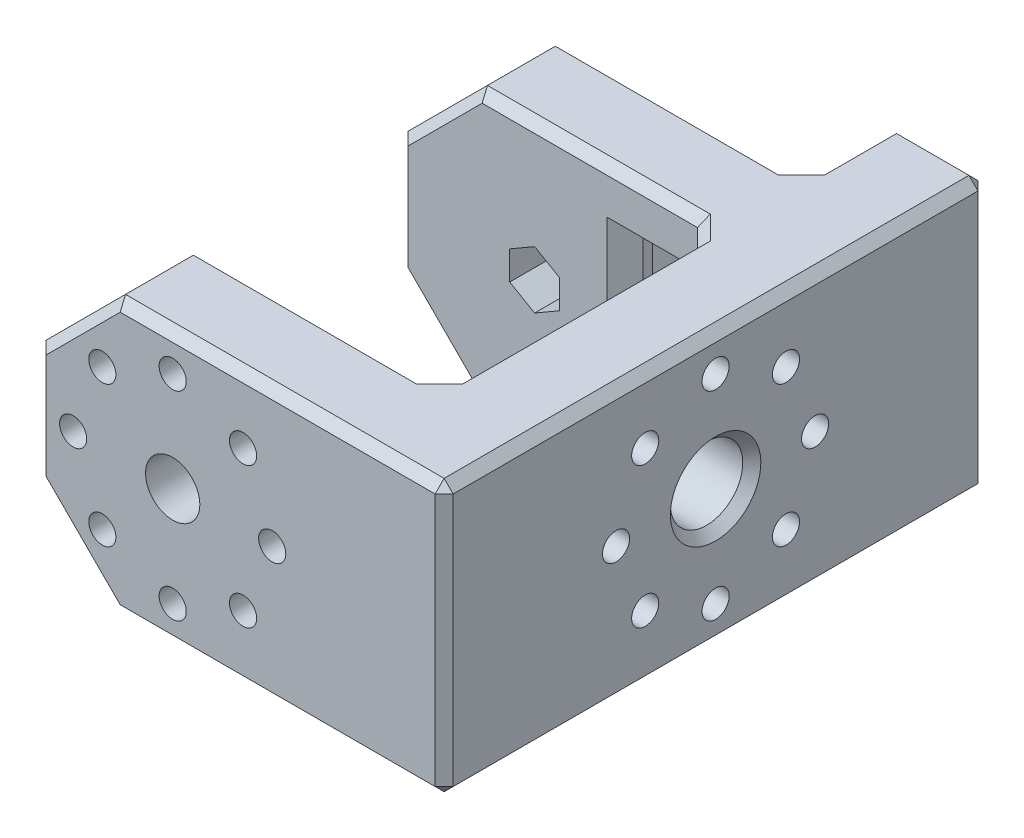
from build123d import *

# Parameters (mm, degrees)
SALIENTE_EXTRUIR1_DEPTH = 60
CROQUIS2_W              = 35
CROQUIS2_H              = 30.5
CROQUIS2_H_2            = 10.5
CORTAR_EXTRUIR1_DEPTH   = 74.484692283
CORTAR_EXTRUIR2_REACH   = 70.739
CROQUIS3_R              = 3
CROQUIS12_R             = 6
SALIENTE_EXTRUIR2_DEPTH = 1
CORTAR_EXTRUIR3_REACH   = 62.624
CROQUIS4_R              = 1.5
CORTAR_EXTRUIR4_DEPTH   = 5
CROQUIS9_W              = 10
CROQUIS9_H              = 20
CORTAR_EXTRUIR7_DEPTH   = 5
CORTAR_EXTRUIR5_REACH   = 78.485
CROQUIS7_R              = 4
CROQUIS7_R_2            = 1.5
CORTAR_EXTRUIR6_REACH   = 83.485
CORTAR_EXTRUIR6_START   = -5
CORTAR_EXTRUIR8_REACH   = 70.739
CROQUIS10_R             = 1.5
CORTAR_EXTRUIR9_REACH   = 75.739
CORTAR_EXTRUIR9_START   = -5
CHAFL_N5_SIZE           = 0.5
CHAFL_N6_SIZE           = 1
CHAFL_N4_SIZE           = 1
CHAFL_N3_SIZE           = 1
CHAFL_N1_SIZE           = 2
CHAFL_N2_SIZE           = 1


# Some blends are built 0.0001 mm under size
with BuildPart() as part:
    # Croquis1 → Saliente-Extruir1 (new body)
    with BuildSketch(Plane.XY):
        Polygon((6.213203436, 15), (30, 15), (30, -15), (6.213203436, -15), (-6.213203436, -15), (-15, -6.213203436), (-15, 6.213203436), (-6.213203436, 15), align=None)
    extrude(amount=SALIENTE_EXTRUIR1_DEPTH)

    # Croquis2 → Cortar-Extruir1 (cut, through all)
    with BuildSketch(Plane(origin=(0, 15, 0), x_dir=(1, 0, 0), z_dir=(0, 1, 0))):
        with Locations((2.5, -35.25)):
            Rectangle(CROQUIS2_W, CROQUIS2_H)
        with Locations((2.5, -5.25)):
            Rectangle(CROQUIS2_W, CROQUIS2_H_2)
    extrude(amount=-CORTAR_EXTRUIR1_DEPTH, mode=Mode.SUBTRACT)

    # Croquis3 → Cortar-Extruir2 (cut, up to next)
    with BuildSketch(Plane.XY.offset(60), mode=Mode.PRIVATE) as cortar_extruir2_sk1:
        Circle(CROQUIS3_R)
    cortar_extruir2_tool1 = extrude(cortar_extruir2_sk1.sketch, amount=-CORTAR_EXTRUIR2_REACH, mode=Mode.PRIVATE) & part.part
    add(cortar_extruir2_tool1.solids().sort_by_distance((0, 0, 60))[0], mode=Mode.SUBTRACT)

    # Croquis12 → Saliente-Extruir2 (add)
    with BuildSketch(Plane(origin=(0, 0, 10.5), x_dir=(-1, 0, 0), z_dir=(0, 0, -1))):
        with Locations(Location((0, 0, 0), (0, 0, 180))):
            Circle(CROQUIS12_R)
    extrude(amount=SALIENTE_EXTRUIR2_DEPTH)

    # Croquis4 → Cortar-Extruir3 (cut, up to next)
    with BuildSketch(Plane(origin=(0, 0, 9.5), x_dir=(-1, 0, 0), z_dir=(0, 0, -1)), mode=Mode.PRIVATE) as cortar_extruir3_sk1:
        Circle(CROQUIS4_R)
    cortar_extruir3_tool1 = extrude(cortar_extruir3_sk1.sketch, amount=-CORTAR_EXTRUIR3_REACH, mode=Mode.PRIVATE) & part.part
    add(cortar_extruir3_tool1.solids().sort_by_distance((0, 0, 9.5))[0], mode=Mode.SUBTRACT)

    # Croquis5 → Cortar-Extruir4 (cut)
    with BuildSketch(Plane.XY.offset(20)):
        Polygon((0, 3.175426481), (-2.75, 1.58771324), (-2.75, -1.58771324), (0, -3.175426481), (2.75, -1.58771324), (2.75, 1.58771324), align=None)
    extrude(amount=-CORTAR_EXTRUIR4_DEPTH, mode=Mode.SUBTRACT)

    # Croquis9 → Cortar-Extruir7 (cut)
    with BuildSketch(Plane.XY.offset(20)):
        with Locations((15, 0)):
            Rectangle(CROQUIS9_W, CROQUIS9_H)
    extrude(amount=-CORTAR_EXTRUIR7_DEPTH, mode=Mode.SUBTRACT)

    # Croquis7 → Cortar-Extruir5 (cut, up to next)
    with BuildSketch(Plane(origin=(30, 0, 0), x_dir=(0, 0, -1), z_dir=(1, 0, 0)), mode=Mode.PRIVATE) as cortar_extruir5_sk1:
        with Locations(Location((-30, 0, 0), (0, 0, 90))):
            Circle(CROQUIS7_R)
    cortar_extruir5_tool1 = extrude(cortar_extruir5_sk1.sketch, amount=-CORTAR_EXTRUIR5_REACH, mode=Mode.PRIVATE) & part.part
    # Croquis7 → Cortar-Extruir5 (cut, up to next)
    with BuildSketch(Plane(origin=(30, 0, 0), x_dir=(0, 0, -1), z_dir=(1, 0, 0)), mode=Mode.PRIVATE) as cortar_extruir5_sk2:
        with Locations(Location((-30, 11, 0), (0, 0, 90))):
            Circle(CROQUIS7_R_2)
    cortar_extruir5_tool2 = extrude(cortar_extruir5_sk2.sketch, amount=-CORTAR_EXTRUIR5_REACH, mode=Mode.PRIVATE) & part.part
    # Croquis7 → Cortar-Extruir5 (cut, up to next)
    with BuildSketch(Plane(origin=(30, 0, 0), x_dir=(0, 0, -1), z_dir=(1, 0, 0)), mode=Mode.PRIVATE) as cortar_extruir5_sk3:
        with Locations(Location((-22.221825407, 7.778174593, 0), (0, 0, 90))):
            Circle(CROQUIS7_R_2)
    cortar_extruir5_tool3 = extrude(cortar_extruir5_sk3.sketch, amount=-CORTAR_EXTRUIR5_REACH, mode=Mode.PRIVATE) & part.part
    # Croquis7 → Cortar-Extruir5 (cut, up to next)
    with BuildSketch(Plane(origin=(30, 0, 0), x_dir=(0, 0, -1), z_dir=(1, 0, 0)), mode=Mode.PRIVATE) as cortar_extruir5_sk4:
        with Locations(Location((-19, 0, 0), (0, 0, 90))):
            Circle(CROQUIS7_R_2)
    cortar_extruir5_tool4 = extrude(cortar_extruir5_sk4.sketch, amount=-CORTAR_EXTRUIR5_REACH, mode=Mode.PRIVATE) & part.part
    # Croquis7 → Cortar-Extruir5 (cut, up to next)
    with BuildSketch(Plane(origin=(30, 0, 0), x_dir=(0, 0, -1), z_dir=(1, 0, 0)), mode=Mode.PRIVATE) as cortar_extruir5_sk5:
        with Locations(Location((-22.221825407, -7.778174593, 0), (0, 0, 90))):
            Circle(CROQUIS7_R_2)
    cortar_extruir5_tool5 = extrude(cortar_extruir5_sk5.sketch, amount=-CORTAR_EXTRUIR5_REACH, mode=Mode.PRIVATE) & part.part
    # Croquis7 → Cortar-Extruir5 (cut, up to next)
    with BuildSketch(Plane(origin=(30, 0, 0), x_dir=(0, 0, -1), z_dir=(1, 0, 0)), mode=Mode.PRIVATE) as cortar_extruir5_sk6:
        with Locations(Location((-30, -11, 0), (0, 0, 90))):
            Circle(CROQUIS7_R_2)
    cortar_extruir5_tool6 = extrude(cortar_extruir5_sk6.sketch, amount=-CORTAR_EXTRUIR5_REACH, mode=Mode.PRIVATE) & part.part
    # Croquis7 → Cortar-Extruir5 (cut, up to next)
    with BuildSketch(Plane(origin=(30, 0, 0), x_dir=(0, 0, -1), z_dir=(1, 0, 0)), mode=Mode.PRIVATE) as cortar_extruir5_sk7:
        with Locations(Location((-37.778174593, -7.778174593, 0), (0, 0, 90))):
            Circle(CROQUIS7_R_2)
    cortar_extruir5_tool7 = extrude(cortar_extruir5_sk7.sketch, amount=-CORTAR_EXTRUIR5_REACH, mode=Mode.PRIVATE) & part.part
    # Croquis7 → Cortar-Extruir5 (cut, up to next)
    with BuildSketch(Plane(origin=(30, 0, 0), x_dir=(0, 0, -1), z_dir=(1, 0, 0)), mode=Mode.PRIVATE) as cortar_extruir5_sk8:
        with Locations(Location((-41, 0, 0), (0, 0, 90))):
            Circle(CROQUIS7_R_2)
    cortar_extruir5_tool8 = extrude(cortar_extruir5_sk8.sketch, amount=-CORTAR_EXTRUIR5_REACH, mode=Mode.PRIVATE) & part.part
    # Croquis7 → Cortar-Extruir5 (cut, up to next)
    with BuildSketch(Plane(origin=(30, 0, 0), x_dir=(0, 0, -1), z_dir=(1, 0, 0)), mode=Mode.PRIVATE) as cortar_extruir5_sk9:
        with Locations(Location((-37.778174593, 7.778174593, 0), (0, 0, 90))):
            Circle(CROQUIS7_R_2)
    cortar_extruir5_tool9 = extrude(cortar_extruir5_sk9.sketch, amount=-CORTAR_EXTRUIR5_REACH, mode=Mode.PRIVATE) & part.part
    add(cortar_extruir5_tool1.solids().sort_by_distance((30, 0, 30))[0], mode=Mode.SUBTRACT)
    add(cortar_extruir5_tool2.solids().sort_by_distance((30, 11, 30))[0], mode=Mode.SUBTRACT)
    add(cortar_extruir5_tool3.solids().sort_by_distance((30, 7.778175, 22.221825))[0], mode=Mode.SUBTRACT)
    add(cortar_extruir5_tool4.solids().sort_by_distance((30, 0, 19))[0], mode=Mode.SUBTRACT)
    add(cortar_extruir5_tool5.solids().sort_by_distance((30, -7.778175, 22.221825))[0], mode=Mode.SUBTRACT)
    add(cortar_extruir5_tool6.solids().sort_by_distance((30, -11, 30))[0], mode=Mode.SUBTRACT)
    add(cortar_extruir5_tool7.solids().sort_by_distance((30, -7.778175, 37.778175))[0], mode=Mode.SUBTRACT)
    add(cortar_extruir5_tool8.solids().sort_by_distance((30, 0, 41))[0], mode=Mode.SUBTRACT)
    add(cortar_extruir5_tool9.solids().sort_by_distance((30, 7.778175, 37.778175))[0], mode=Mode.SUBTRACT)

    # Croquis8 → Cortar-Extruir6 (cut, up to next)
    with BuildSketch(Plane(origin=(30, 0, 0), x_dir=(0, 0, -1), z_dir=(1, 0, 0)).offset(CORTAR_EXTRUIR6_START), mode=Mode.PRIVATE) as cortar_extruir6_sk1:
        Polygon((-19.976459809, 5.532808996), (-19.15459896, 8.600035443), (-21.399964557, 10.84540104), (-24.467191004, 10.023540191), (-25.289051854, 6.956313744), (-23.043686256, 4.710948146), align=None)
    cortar_extruir6_tool1 = extrude(cortar_extruir6_sk1.sketch, amount=-CORTAR_EXTRUIR6_REACH, mode=Mode.PRIVATE) & part.part
    # Croquis8 → Cortar-Extruir6 (cut, up to next)
    with BuildSketch(Plane(origin=(30, 0, 0), x_dir=(0, 0, -1), z_dir=(1, 0, 0)).offset(CORTAR_EXTRUIR6_START), mode=Mode.PRIVATE) as cortar_extruir6_sk2:
        Polygon((-26.824573519, 11), (-28.41228676, 13.75), (-31.58771324, 13.75), (-33.175426481, 11), (-31.58771324, 8.25), (-28.41228676, 8.25), align=None)
    cortar_extruir6_tool2 = extrude(cortar_extruir6_sk2.sketch, amount=-CORTAR_EXTRUIR6_REACH, mode=Mode.PRIVATE) & part.part
    # Croquis8 → Cortar-Extruir6 (cut, up to next)
    with BuildSketch(Plane(origin=(30, 0, 0), x_dir=(0, 0, -1), z_dir=(1, 0, 0)).offset(CORTAR_EXTRUIR6_START), mode=Mode.PRIVATE) as cortar_extruir6_sk3:
        Polygon((-19, -3.175426481), (-16.25, -1.58771324), (-16.25, 1.58771324), (-19, 3.175426481), (-21.75, 1.58771324), (-21.75, -1.58771324), align=None)
    cortar_extruir6_tool3 = extrude(cortar_extruir6_sk3.sketch, amount=-CORTAR_EXTRUIR6_REACH, mode=Mode.PRIVATE) & part.part
    # Croquis8 → Cortar-Extruir6 (cut, up to next)
    with BuildSketch(Plane(origin=(30, 0, 0), x_dir=(0, 0, -1), z_dir=(1, 0, 0)).offset(CORTAR_EXTRUIR6_START), mode=Mode.PRIVATE) as cortar_extruir6_sk4:
        Polygon((-24.467191004, -10.023540191), (-21.399964557, -10.84540104), (-19.15459896, -8.600035443), (-19.976459809, -5.532808996), (-23.043686256, -4.710948146), (-25.289051854, -6.956313744), align=None)
    cortar_extruir6_tool4 = extrude(cortar_extruir6_sk4.sketch, amount=-CORTAR_EXTRUIR6_REACH, mode=Mode.PRIVATE) & part.part
    # Croquis8 → Cortar-Extruir6 (cut, up to next)
    with BuildSketch(Plane(origin=(30, 0, 0), x_dir=(0, 0, -1), z_dir=(1, 0, 0)).offset(CORTAR_EXTRUIR6_START), mode=Mode.PRIVATE) as cortar_extruir6_sk5:
        Polygon((-33.175426481, -11), (-31.58771324, -13.75), (-28.41228676, -13.75), (-26.824573519, -11), (-28.41228676, -8.25), (-31.58771324, -8.25), align=None)
    cortar_extruir6_tool5 = extrude(cortar_extruir6_sk5.sketch, amount=-CORTAR_EXTRUIR6_REACH, mode=Mode.PRIVATE) & part.part
    # Croquis8 → Cortar-Extruir6 (cut, up to next)
    with BuildSketch(Plane(origin=(30, 0, 0), x_dir=(0, 0, -1), z_dir=(1, 0, 0)).offset(CORTAR_EXTRUIR6_START), mode=Mode.PRIVATE) as cortar_extruir6_sk6:
        Polygon((-40.023540191, -5.532808996), (-40.84540104, -8.600035443), (-38.600035443, -10.84540104), (-35.532808996, -10.023540191), (-34.710948146, -6.956313744), (-36.956313744, -4.710948146), align=None)
    cortar_extruir6_tool6 = extrude(cortar_extruir6_sk6.sketch, amount=-CORTAR_EXTRUIR6_REACH, mode=Mode.PRIVATE) & part.part
    # Croquis8 → Cortar-Extruir6 (cut, up to next)
    with BuildSketch(Plane(origin=(30, 0, 0), x_dir=(0, 0, -1), z_dir=(1, 0, 0)).offset(CORTAR_EXTRUIR6_START), mode=Mode.PRIVATE) as cortar_extruir6_sk7:
        Polygon((-41, 3.175426481), (-43.75, 1.58771324), (-43.75, -1.58771324), (-41, -3.175426481), (-38.25, -1.58771324), (-38.25, 1.58771324), align=None)
    cortar_extruir6_tool7 = extrude(cortar_extruir6_sk7.sketch, amount=-CORTAR_EXTRUIR6_REACH, mode=Mode.PRIVATE) & part.part
    # Croquis8 → Cortar-Extruir6 (cut, up to next)
    with BuildSketch(Plane(origin=(30, 0, 0), x_dir=(0, 0, -1), z_dir=(1, 0, 0)).offset(CORTAR_EXTRUIR6_START), mode=Mode.PRIVATE) as cortar_extruir6_sk8:
        Polygon((-35.532808996, 10.023540191), (-38.600035443, 10.84540104), (-40.84540104, 8.600035443), (-40.023540191, 5.532808996), (-36.956313744, 4.710948146), (-34.710948146, 6.956313744), align=None)
    cortar_extruir6_tool8 = extrude(cortar_extruir6_sk8.sketch, amount=-CORTAR_EXTRUIR6_REACH, mode=Mode.PRIVATE) & part.part
    add(cortar_extruir6_tool1.solids().sort_by_distance((25, 7.778175, 22.221825))[0], mode=Mode.SUBTRACT)
    add(cortar_extruir6_tool2.solids().sort_by_distance((25, 11, 30))[0], mode=Mode.SUBTRACT)
    add(cortar_extruir6_tool3.solids().sort_by_distance((25, 0, 19))[0], mode=Mode.SUBTRACT)
    add(cortar_extruir6_tool4.solids().sort_by_distance((25, -7.778175, 22.221825))[0], mode=Mode.SUBTRACT)
    add(cortar_extruir6_tool5.solids().sort_by_distance((25, -11, 30))[0], mode=Mode.SUBTRACT)
    add(cortar_extruir6_tool6.solids().sort_by_distance((25, -7.778175, 37.778175))[0], mode=Mode.SUBTRACT)
    add(cortar_extruir6_tool7.solids().sort_by_distance((25, 0, 41))[0], mode=Mode.SUBTRACT)
    add(cortar_extruir6_tool8.solids().sort_by_distance((25, 7.778175, 37.778175))[0], mode=Mode.SUBTRACT)

    # Croquis10 → Cortar-Extruir8 (cut, up to next)
    with BuildSketch(Plane.XY.offset(60), mode=Mode.PRIVATE) as cortar_extruir8_sk1:
        with Locations((0, 11)):
            Circle(CROQUIS10_R)
    cortar_extruir8_tool1 = extrude(cortar_extruir8_sk1.sketch, amount=-CORTAR_EXTRUIR8_REACH, mode=Mode.PRIVATE) & part.part
    # Croquis10 → Cortar-Extruir8 (cut, up to next)
    with BuildSketch(Plane.XY.offset(60), mode=Mode.PRIVATE) as cortar_extruir8_sk2:
        with Locations((7.778174593, 7.778174593)):
            Circle(CROQUIS10_R)
    cortar_extruir8_tool2 = extrude(cortar_extruir8_sk2.sketch, amount=-CORTAR_EXTRUIR8_REACH, mode=Mode.PRIVATE) & part.part
    # Croquis10 → Cortar-Extruir8 (cut, up to next)
    with BuildSketch(Plane.XY.offset(60), mode=Mode.PRIVATE) as cortar_extruir8_sk3:
        with Locations((11, 0)):
            Circle(CROQUIS10_R)
    cortar_extruir8_tool3 = extrude(cortar_extruir8_sk3.sketch, amount=-CORTAR_EXTRUIR8_REACH, mode=Mode.PRIVATE) & part.part
    # Croquis10 → Cortar-Extruir8 (cut, up to next)
    with BuildSketch(Plane.XY.offset(60), mode=Mode.PRIVATE) as cortar_extruir8_sk4:
        with Locations((7.778174593, -7.778174593)):
            Circle(CROQUIS10_R)
    cortar_extruir8_tool4 = extrude(cortar_extruir8_sk4.sketch, amount=-CORTAR_EXTRUIR8_REACH, mode=Mode.PRIVATE) & part.part
    # Croquis10 → Cortar-Extruir8 (cut, up to next)
    with BuildSketch(Plane.XY.offset(60), mode=Mode.PRIVATE) as cortar_extruir8_sk5:
        with Locations((0, -11)):
            Circle(CROQUIS10_R)
    cortar_extruir8_tool5 = extrude(cortar_extruir8_sk5.sketch, amount=-CORTAR_EXTRUIR8_REACH, mode=Mode.PRIVATE) & part.part
    # Croquis10 → Cortar-Extruir8 (cut, up to next)
    with BuildSketch(Plane.XY.offset(60), mode=Mode.PRIVATE) as cortar_extruir8_sk6:
        with Locations((-7.778174593, -7.778174593)):
            Circle(CROQUIS10_R)
    cortar_extruir8_tool6 = extrude(cortar_extruir8_sk6.sketch, amount=-CORTAR_EXTRUIR8_REACH, mode=Mode.PRIVATE) & part.part
    # Croquis10 → Cortar-Extruir8 (cut, up to next)
    with BuildSketch(Plane.XY.offset(60), mode=Mode.PRIVATE) as cortar_extruir8_sk7:
        with Locations((-11, 0)):
            Circle(CROQUIS10_R)
    cortar_extruir8_tool7 = extrude(cortar_extruir8_sk7.sketch, amount=-CORTAR_EXTRUIR8_REACH, mode=Mode.PRIVATE) & part.part
    # Croquis10 → Cortar-Extruir8 (cut, up to next)
    with BuildSketch(Plane.XY.offset(60), mode=Mode.PRIVATE) as cortar_extruir8_sk8:
        with Locations((-7.778174593, 7.778174593)):
            Circle(CROQUIS10_R)
    cortar_extruir8_tool8 = extrude(cortar_extruir8_sk8.sketch, amount=-CORTAR_EXTRUIR8_REACH, mode=Mode.PRIVATE) & part.part
    add(cortar_extruir8_tool1.solids().sort_by_distance((0, 11, 60))[0], mode=Mode.SUBTRACT)
    add(cortar_extruir8_tool2.solids().sort_by_distance((7.778175, 7.778175, 60))[0], mode=Mode.SUBTRACT)
    add(cortar_extruir8_tool3.solids().sort_by_distance((11, 0, 60))[0], mode=Mode.SUBTRACT)
    add(cortar_extruir8_tool4.solids().sort_by_distance((7.778175, -7.778175, 60))[0], mode=Mode.SUBTRACT)
    add(cortar_extruir8_tool5.solids().sort_by_distance((0, -11, 60))[0], mode=Mode.SUBTRACT)
    add(cortar_extruir8_tool6.solids().sort_by_distance((-7.778175, -7.778175, 60))[0], mode=Mode.SUBTRACT)
    add(cortar_extruir8_tool7.solids().sort_by_distance((-11, 0, 60))[0], mode=Mode.SUBTRACT)
    add(cortar_extruir8_tool8.solids().sort_by_distance((-7.778175, 7.778175, 60))[0], mode=Mode.SUBTRACT)

    # Croquis11 → Cortar-Extruir9 (cut, up to next)
    with BuildSketch(Plane.XY.offset(60).offset(CORTAR_EXTRUIR9_START), mode=Mode.PRIVATE) as cortar_extruir9_sk1:
        Polygon((10.023540191, 5.532808996), (10.84540104, 8.600035443), (8.600035443, 10.84540104), (5.532808996, 10.023540191), (4.710948146, 6.956313744), (6.956313744, 4.710948146), align=None)
    cortar_extruir9_tool1 = extrude(cortar_extruir9_sk1.sketch, amount=-CORTAR_EXTRUIR9_REACH, mode=Mode.PRIVATE) & part.part
    # Croquis11 → Cortar-Extruir9 (cut, up to next)
    with BuildSketch(Plane.XY.offset(60).offset(CORTAR_EXTRUIR9_START), mode=Mode.PRIVATE) as cortar_extruir9_sk2:
        Polygon((3.175426481, 11), (1.58771324, 13.75), (-1.58771324, 13.75), (-3.175426481, 11), (-1.58771324, 8.25), (1.58771324, 8.25), align=None)
    cortar_extruir9_tool2 = extrude(cortar_extruir9_sk2.sketch, amount=-CORTAR_EXTRUIR9_REACH, mode=Mode.PRIVATE) & part.part
    # Croquis11 → Cortar-Extruir9 (cut, up to next)
    with BuildSketch(Plane.XY.offset(60).offset(CORTAR_EXTRUIR9_START), mode=Mode.PRIVATE) as cortar_extruir9_sk3:
        Polygon((11, -3.175426481), (13.75, -1.58771324), (13.75, 1.58771324), (11, 3.175426481), (8.25, 1.58771324), (8.25, -1.58771324), align=None)
    cortar_extruir9_tool3 = extrude(cortar_extruir9_sk3.sketch, amount=-CORTAR_EXTRUIR9_REACH, mode=Mode.PRIVATE) & part.part
    # Croquis11 → Cortar-Extruir9 (cut, up to next)
    with BuildSketch(Plane.XY.offset(60).offset(CORTAR_EXTRUIR9_START), mode=Mode.PRIVATE) as cortar_extruir9_sk4:
        Polygon((5.532808996, -10.023540191), (8.600035443, -10.84540104), (10.84540104, -8.600035443), (10.023540191, -5.532808996), (6.956313744, -4.710948146), (4.710948146, -6.956313744), align=None)
    cortar_extruir9_tool4 = extrude(cortar_extruir9_sk4.sketch, amount=-CORTAR_EXTRUIR9_REACH, mode=Mode.PRIVATE) & part.part
    # Croquis11 → Cortar-Extruir9 (cut, up to next)
    with BuildSketch(Plane.XY.offset(60).offset(CORTAR_EXTRUIR9_START), mode=Mode.PRIVATE) as cortar_extruir9_sk5:
        Polygon((-3.175426481, -11), (-1.58771324, -13.75), (1.58771324, -13.75), (3.175426481, -11), (1.58771324, -8.25), (-1.58771324, -8.25), align=None)
    cortar_extruir9_tool5 = extrude(cortar_extruir9_sk5.sketch, amount=-CORTAR_EXTRUIR9_REACH, mode=Mode.PRIVATE) & part.part
    # Croquis11 → Cortar-Extruir9 (cut, up to next)
    with BuildSketch(Plane.XY.offset(60).offset(CORTAR_EXTRUIR9_START), mode=Mode.PRIVATE) as cortar_extruir9_sk6:
        Polygon((-10.023540191, -5.532808996), (-10.84540104, -8.600035443), (-8.600035443, -10.84540104), (-5.532808995, -10.023540191), (-4.710948146, -6.956313744), (-6.956313744, -4.710948146), align=None)
    cortar_extruir9_tool6 = extrude(cortar_extruir9_sk6.sketch, amount=-CORTAR_EXTRUIR9_REACH, mode=Mode.PRIVATE) & part.part
    # Croquis11 → Cortar-Extruir9 (cut, up to next)
    with BuildSketch(Plane.XY.offset(60).offset(CORTAR_EXTRUIR9_START), mode=Mode.PRIVATE) as cortar_extruir9_sk7:
        Polygon((-11, 3.175426481), (-13.75, 1.58771324), (-13.75, -1.58771324), (-11, -3.175426481), (-8.25, -1.58771324), (-8.25, 1.58771324), align=None)
    cortar_extruir9_tool7 = extrude(cortar_extruir9_sk7.sketch, amount=-CORTAR_EXTRUIR9_REACH, mode=Mode.PRIVATE) & part.part
    # Croquis11 → Cortar-Extruir9 (cut, up to next)
    with BuildSketch(Plane.XY.offset(60).offset(CORTAR_EXTRUIR9_START), mode=Mode.PRIVATE) as cortar_extruir9_sk8:
        Polygon((-5.532808996, 10.023540191), (-8.600035443, 10.84540104), (-10.84540104, 8.600035443), (-10.023540191, 5.532808996), (-6.956313744, 4.710948146), (-4.710948146, 6.956313744), align=None)
    cortar_extruir9_tool8 = extrude(cortar_extruir9_sk8.sketch, amount=-CORTAR_EXTRUIR9_REACH, mode=Mode.PRIVATE) & part.part
    add(cortar_extruir9_tool1.solids().sort_by_distance((7.778175, 7.778175, 55))[0], mode=Mode.SUBTRACT)
    add(cortar_extruir9_tool2.solids().sort_by_distance((0, 11, 55))[0], mode=Mode.SUBTRACT)
    add(cortar_extruir9_tool3.solids().sort_by_distance((11, 0, 55))[0], mode=Mode.SUBTRACT)
    add(cortar_extruir9_tool4.solids().sort_by_distance((7.778175, -7.778175, 55))[0], mode=Mode.SUBTRACT)
    add(cortar_extruir9_tool5.solids().sort_by_distance((0, -11, 55))[0], mode=Mode.SUBTRACT)
    add(cortar_extruir9_tool6.solids().sort_by_distance((-7.778175, -7.778175, 55))[0], mode=Mode.SUBTRACT)
    add(cortar_extruir9_tool7.solids().sort_by_distance((-11, 0, 55))[0], mode=Mode.SUBTRACT)
    add(cortar_extruir9_tool8.solids().sort_by_distance((-7.778175, 7.778175, 55))[0], mode=Mode.SUBTRACT)

    # Chaflán5
    chafl_n5_edges = [part.edges().sort_by_distance(p)[0] for p in [
        (1.5, 0, 9.5),
    ]]
    chamfer(chafl_n5_edges, length=CHAFL_N5_SIZE)

    # Chaflán6
    chafl_n6_edges = [part.edges().sort_by_distance(p)[0] for p in [
        (-6, 0, 10.5),
    ]]
    chamfer(chafl_n6_edges, length=CHAFL_N6_SIZE - 0.0001)  # a hair under: the kernel refuses the full size

    # Chaflán4
    chafl_n4_edges = [part.edges().sort_by_distance(p)[0] for p in [
        (30, -4, 30),
        (20, -4, 30),
    ]]
    chamfer(chafl_n4_edges, length=CHAFL_N4_SIZE)

    # Chaflán3
    chafl_n3_edges = [part.edges().sort_by_distance(p)[0] for p in [
        (-3, 0, 50.5),
    ]]
    chamfer(chafl_n3_edges, length=CHAFL_N3_SIZE)

    # Chaflán1
    # the kernel refuses this chamfer: 2 mm, written as the material it adds along each edge
    with BuildSketch(Plane(origin=(20, 15, 50.5), x_dir=(-0.9996219169112968, 0, 0.027495876610585647), z_dir=(0, -1, 0)), Plane(origin=(20, 15, 10.5), x_dir=(-0.9996219169112968, 0, 0.02749587661058651), z_dir=(0, -1, 0))) as chafl_n1_piece_1:
        Polygon((CHAFL_N1_SIZE * 0.999621916911, CHAFL_N1_SIZE * 0.0274958766106), (-CHAFL_N1_SIZE * 0.0274958766106, CHAFL_N1_SIZE * 0.999621916911), (0, 0), align=None)
    extrude(amount=30)
    with BuildSketch(Plane(origin=(20, -10, 20), x_dir=(0.027495876610585647, 0, 0.9996219169112968), z_dir=(0, -1, 0))) as chafl_n1_piece_2_section:
        Polygon((CHAFL_N1_SIZE * 0.999621916911, CHAFL_N1_SIZE * 0.0274958766106), (-CHAFL_N1_SIZE * 0.0274958766106, CHAFL_N1_SIZE * 0.999621916911), (0, 0), align=None)
    chafl_n1_piece_2 = extrude(amount=5, mode=Mode.PRIVATE)
    chafl_n1_piece_2 = split(chafl_n1_piece_2, bisect_by=Plane(origin=(19.216720762, -10.235610769, 20.790174286), z_dir=(0, -0.7071067811865523, -0.7071067811865428)), keep=Keep.TOP, mode=Mode.PRIVATE)
    add(chafl_n1_piece_2)
    with BuildSketch(Plane(origin=(20, -4.856634024, 20), x_dir=(0.027495876610585647, 0, 0.9996219169112968), z_dir=(0, -1, 0))) as chafl_n1_piece_3_section:
        Polygon((CHAFL_N1_SIZE * 0.999621916911, CHAFL_N1_SIZE * 0.0274958766106), (-CHAFL_N1_SIZE * 0.0274958766106, CHAFL_N1_SIZE * 0.999621916911), (0, 0), align=None)
    chafl_n1_piece_3 = extrude(amount=15.286731952, mode=Mode.PRIVATE)
    chafl_n1_piece_3 = split(chafl_n1_piece_3, bisect_by=Plane(origin=(19.849991139, -11.050316955, 21.604880472), z_dir=(0, 0.7071067811865523, 0.7071067811865428)), keep=Keep.TOP, mode=Mode.PRIVATE)
    chafl_n1_piece_3 = split(chafl_n1_piece_3, bisect_by=Plane(origin=(19.849991139, -10.77775276, 21.652431375), z_dir=(0, -0.9659258262890669, 0.2588190451025261)), keep=Keep.TOP, mode=Mode.PRIVATE)
    add(chafl_n1_piece_3)
    with BuildSketch(Plane(origin=(20, 15, 20), x_dir=(0.027495876610585647, 0, 0.9996219169112968), z_dir=(0, -1, 0))) as chafl_n1_piece_4_section:
        Polygon((CHAFL_N1_SIZE * 0.999621916911, CHAFL_N1_SIZE * 0.0274958766106), (-CHAFL_N1_SIZE * 0.0274958766106, CHAFL_N1_SIZE * 0.999621916911), (0, 0), align=None)
    chafl_n1_piece_4 = extrude(amount=10.143365976, mode=Mode.PRIVATE)
    chafl_n1_piece_4 = split(chafl_n1_piece_4, bisect_by=Plane(origin=(19.337901825, 11.172841883, 20.177938697), z_dir=(0, 0.965925826289068, 0.2588190451025222)), keep=Keep.TOP, mode=Mode.PRIVATE)
    add(chafl_n1_piece_4)
    with BuildSketch(Plane(origin=(20, 20.143365976, 20), x_dir=(0.027495876610585647, 0, 0.9996219169112968), z_dir=(0, -1, 0))) as chafl_n1_piece_5_section:
        Polygon((CHAFL_N1_SIZE * 0.999621916911, CHAFL_N1_SIZE * 0.0274958766106), (-CHAFL_N1_SIZE * 0.0274958766106, CHAFL_N1_SIZE * 0.999621916911), (0, 0), align=None)
    chafl_n1_piece_5 = extrude(amount=10.143365976, mode=Mode.PRIVATE)
    chafl_n1_piece_5 = split(chafl_n1_piece_5, bisect_by=Plane(origin=(19.216720762, 10.235610769, 20.790174286), z_dir=(0, 0.7071067811865456, -0.7071067811865496)), keep=Keep.TOP, mode=Mode.PRIVATE)
    chafl_n1_piece_5 = split(chafl_n1_piece_5, bisect_by=Plane(origin=(19.216720762, 11.07008016, 20.561450667), z_dir=(0, -0.965925826289068, -0.2588190451025222)), keep=Keep.TOP, mode=Mode.PRIVATE)
    add(chafl_n1_piece_5)
    with BuildSketch(Plane(origin=(20, 10, 15), x_dir=(0.027495876610582247, 0, 0.999621916911297), z_dir=(0, -1, 0))) as chafl_n1_piece_6_section:
        Polygon((CHAFL_N1_SIZE * 0.999621916911, CHAFL_N1_SIZE * 0.0274958766106), (-CHAFL_N1_SIZE * 0.0274958766106, CHAFL_N1_SIZE * 0.999621916911), (0, 0), align=None)
    chafl_n1_piece_6 = extrude(amount=25.143365976, mode=Mode.PRIVATE)
    chafl_n1_piece_6 = split(chafl_n1_piece_6, bisect_by=Plane(origin=(19.748908907, 2.764442057, 18.288154097), z_dir=(0, 0.8660254037844382, -0.5000000000000009)), keep=Keep.TOP, mode=Mode.PRIVATE)
    add(chafl_n1_piece_6)
    with BuildSketch(Plane(origin=(20, 15.143365976, 15), x_dir=(0.027495876610585647, 0, 0.9996219169112968), z_dir=(0, -1, 0))) as chafl_n1_piece_7_section:
        Polygon((CHAFL_N1_SIZE * 0.999621916911, CHAFL_N1_SIZE * 0.0274958766106), (-CHAFL_N1_SIZE * 0.0274958766106, CHAFL_N1_SIZE * 0.999621916911), (0, 0), align=None)
    chafl_n1_piece_7 = extrude(amount=25.143365976, mode=Mode.PRIVATE)
    chafl_n1_piece_7 = split(chafl_n1_piece_7, bisect_by=Plane(origin=(19.295009328, 0, 16.25), z_dir=(0, 0, -1)), keep=Keep.TOP, mode=Mode.PRIVATE)
    chafl_n1_piece_7 = split(chafl_n1_piece_7, bisect_by=Plane(origin=(19.295009328, 0.905004626, 15.067513993), z_dir=(0, -0.8660254037844382, 0.5000000000000009)), keep=Keep.TOP, mode=Mode.PRIVATE)
    add(chafl_n1_piece_7)
    with BuildSketch(Plane(origin=(20, 15.143365976, 15), x_dir=(0.027495876610585647, 0, 0.9996219169112968), z_dir=(0, -1, 0))) as chafl_n1_piece_8_section:
        Polygon((CHAFL_N1_SIZE * 0.999621916911, CHAFL_N1_SIZE * 0.0274958766106), (-CHAFL_N1_SIZE * 0.0274958766106, CHAFL_N1_SIZE * 0.999621916911), (0, 0), align=None)
    chafl_n1_piece_8 = extrude(amount=25.143365976, mode=Mode.PRIVATE)
    chafl_n1_piece_8 = split(chafl_n1_piece_8, bisect_by=Plane(origin=(19.748908907, -2.764442057, 18.288154097), z_dir=(0, -0.8660254037844408, -0.49999999999999617)), keep=Keep.TOP, mode=Mode.PRIVATE)
    add(chafl_n1_piece_8)
    with BuildSketch(Plane(origin=(10, -10, 15), x_dir=(0.9996219169112968, 0, -0.027495876610586487), z_dir=(0, 1, 0))) as chafl_n1_piece_9:
        Polygon((CHAFL_N1_SIZE * 0.999621916911, -CHAFL_N1_SIZE * 0.0274958766106), (-CHAFL_N1_SIZE * 0.0274958766106, -CHAFL_N1_SIZE * 0.999621916911), (0, 0), align=None)
    extrude(amount=20)
    # the kernel refuses this chamfer: 2 mm, written as the material it takes off along each edge
    with BuildSketch(Plane(origin=(10, -10, 20), x_dir=(-0.9996219169112968, 0, 0.027495876610585623), z_dir=(0, 1, 0))) as chafl_n1_2_piece_1:
        Polygon((CHAFL_N1_SIZE * 0.999621916911, -CHAFL_N1_SIZE * 0.0274958766106), (-CHAFL_N1_SIZE * 0.0274958766106, -CHAFL_N1_SIZE * 0.999621916911), (0, 0), align=None)
    extrude(amount=20, mode=Mode.SUBTRACT)

    # Chaflán2
    chafl_n2_edges = [part.edges().sort_by_distance(p)[0] for p in [
        (11.893398282, 15, 60),
        (30, 0, 0),
        (30, 15, 30),
        (30, -15, 30),
        (-10.606601718, 10.606601718, 60),
        (-15, 0, 60),
        (-10.606601718, -10.606601718, 60),
        (25, -15, 0),
        (5.893398282, -15, 50.5),
        (5.893398282, 15, 50.5),
        (-15, 0, 50.5),
        (-15, 0, 20),
        (-10.606601718, 10.606601718, 20),
        (-10.606601718, -10.606601718, 20),
        (11.893398282, -15, 60),
        (-10.606601718, 10.606601718, 50.5),
        (-10.606601718, -10.606601718, 50.5),
        (-10.606601718, 10.606601718, 10.5),
        (-10.606601718, -10.606601718, 10.5),
        (5.893398282, -15, 10.5),
        (-15, 0, 10.5),
        (5.893398282, 15, 20),
        (5.893398282, -15, 20),
        (5.893398282, 15, 10.5),
        (20, 15, 35.25),
        (20, -15, 35.25),
        (20, 15, 4.25),
        (20, -15, 4.25),
        (19, 15, 21),
        (19, 15, 49.5),
        (19, -15, 49.5),
        (19, -15, 21),
        (20, 0, 0),
        (19, 15, 9.5),
        (19, -15, 9.5),
        (30, 0, 60),
        (25, 15, 0),
    ]]
    chamfer(chafl_n2_edges, length=CHAFL_N2_SIZE)


solid = part.part
